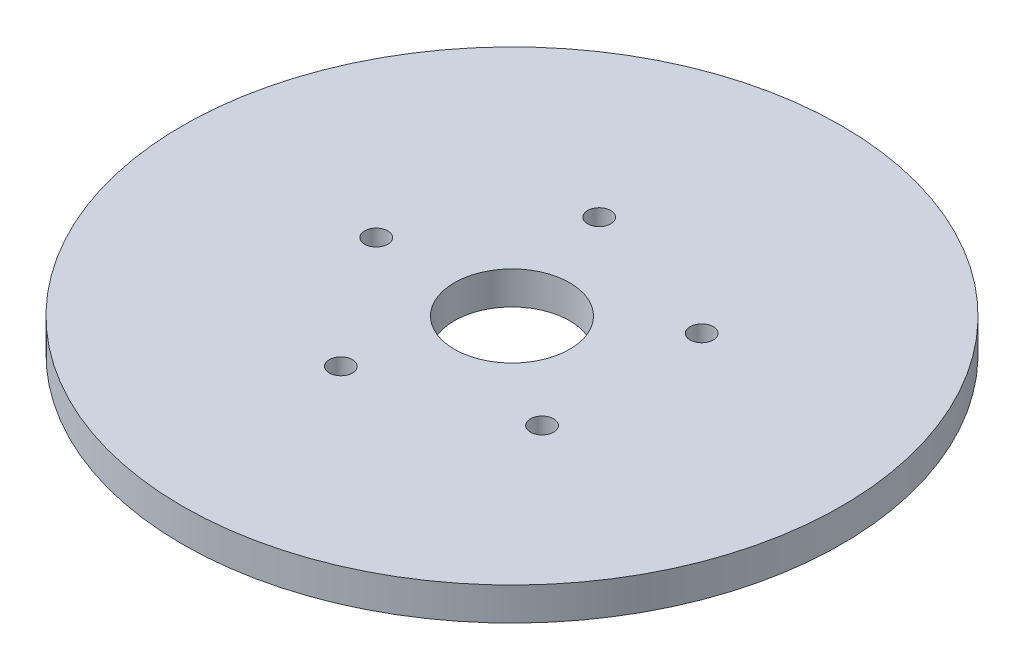
from build123d import *

# Parameters (mm, degrees)
SKETCH1_R           = 100
BOSS_EXTRUDE1_DEPTH = 10
SKETCH2_R           = 17.5
CUT_EXTRUDE1_DEPTH  = 142.774468788
SKETCH3_R           = 3.520810274
CUT_EXTRUDE2_DEPTH  = 7.561113293
CIRPATTERN1_COUNT   = 5


with BuildPart() as part:
    # Sketch1 → Boss-Extrude1 (new body)
    with BuildSketch(Plane(origin=(0, 0, 0), x_dir=(1, 0, 0), z_dir=(0, 1, 0))):
        Circle(SKETCH1_R)
    extrude(amount=BOSS_EXTRUDE1_DEPTH)

    # Sketch2 → Cut-Extrude1 (cut, through all)
    with BuildSketch(Plane(origin=(0, 0, 0), x_dir=(1, 0, 0), z_dir=(0, 1, 0))):
        Circle(SKETCH2_R)
    extrude(amount=CUT_EXTRUDE1_DEPTH, mode=Mode.SUBTRACT)

    # Sketch3 → Cut-Extrude2 (cut)
    with BuildSketch(Plane(origin=(0, 10, 0), x_dir=(1, 0, 0), z_dir=(0, 1, 0))):
        with Locations((-41.208014969, 0)):
            Circle(SKETCH3_R)
    cut_extrude2 = extrude(amount=-CUT_EXTRUDE2_DEPTH, mode=Mode.SUBTRACT)

    # CirPattern1: Cut-Extrude2 ×5 about axis
    cirpattern1_axis = Axis((0, 0, 0), (0, 1, 0))
    for i in range(1, CIRPATTERN1_COUNT):
        add(cut_extrude2.rotate(cirpattern1_axis, i * 360 / CIRPATTERN1_COUNT), mode=Mode.SUBTRACT)


solid = part.part
